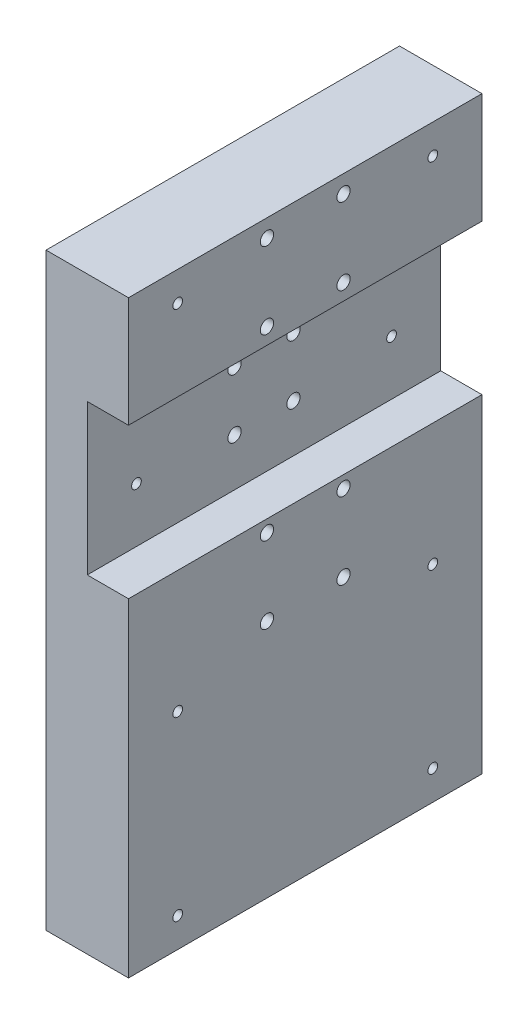
from build123d import *

# Parameters (mm, degrees)
BOSS_EXTRUDE1_DEPTH            = 120
CBORE_FOR_M4_SHCS4_D           = 4.5
CBORE_FOR_M4_SHCS4_CBORE_D     = 8
CBORE_FOR_M4_SHCS4_CBORE_DEPTH = 4
M4_TAPPED_HOLE1_D              = 3.3
M5_TAPPED_HOLE1_D              = 4.2
M5_TAPPED_HOLE1_DEPTH          = 17.4
M5_TAPPED_HOLE1_TIP            = 1.2618073


with BuildPart() as part:
    # Sketch1 → Boss-Extrude1 (new body)
    with BuildSketch(Plane.XY):
        Polygon((0, 0), (0, 200), (28, 200), (28, 162.5), (14, 162.5), (14, 111.5), (28, 111.5), (28, 0), align=None)
    extrude(amount=BOSS_EXTRUDE1_DEPTH)

    # CBORE for M4 SHCS4 (through all)
    with Locations(Plane(origin=(0, 194, 73), x_dir=(0, 0, -1), z_dir=(-1, 0, 0))):
        with Locations((0, 0), (0, 26), (3, 46.3), (3, 66.3), (0, 86.6), (0, 112.6), (26, 112.6), (26, 86.6), (23, 66.3), (23, 46.3), (26, 26), (26, 0)):
            CounterBoreHole(CBORE_FOR_M4_SHCS4_D / 2, CBORE_FOR_M4_SHCS4_CBORE_D / 2, CBORE_FOR_M4_SHCS4_CBORE_DEPTH)

    # M4 Tapped Hole1 (through all)
    with Locations(Plane(origin=(0, 190, 16.7), x_dir=(0, 0, -1), z_dir=(-1, 0, 0))):
        with Locations((0, 0), (0, 60), (0, 120), (0, 180), (-86.6, 180), (-86.6, 120), (-86.6, 60), (-86.6, 0)):
            Hole(M4_TAPPED_HOLE1_D / 2)

    # M5 Tapped Hole1
    with Locations(Plane(origin=(14, 0, 90), x_dir=(-1, 0, 0), z_dir=(0, -1, 0))):
        with Locations((0, 0), (0, 30), (0, 60)):
            Hole(M5_TAPPED_HOLE1_D / 2, depth=M5_TAPPED_HOLE1_DEPTH)
            with Locations((0, 0, -(M5_TAPPED_HOLE1_DEPTH + M5_TAPPED_HOLE1_TIP / 2))):  # 118° drill point
                Cone(0, M5_TAPPED_HOLE1_D / 2, M5_TAPPED_HOLE1_TIP, mode=Mode.SUBTRACT)


solid = part.part
